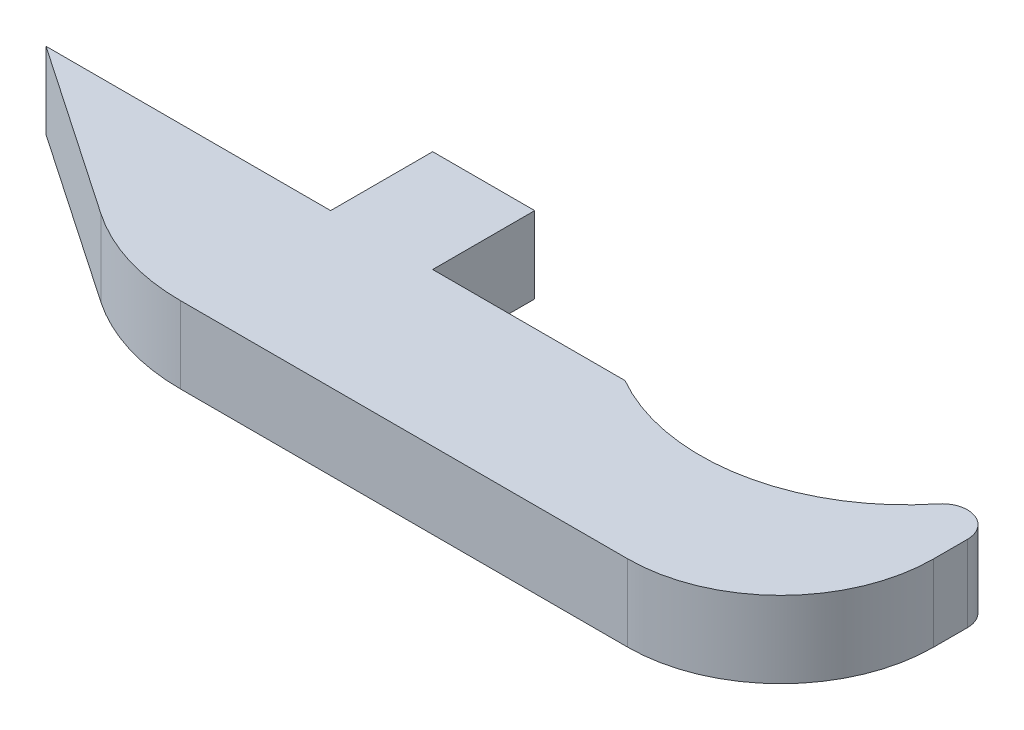
from build123d import *

# Parameters (mm, degrees)
BOSS_EXTRUDE1_DEPTH = 4.7625
FILLET1_R           = 9.525
FILLET2_START       = -1
FILLET2_DEPTH       = 7
FILLET4_R           = 12.7
SKETCH2_W           = 6.35
SKETCH2_H           = 6.35
BOSS_EXTRUDE2_DEPTH = 4.7625


with BuildPart() as part:
    # Sketch1 → Boss-Extrude1 (new body)
    with BuildSketch(Plane(origin=(0, 0, 0), x_dir=(1, 0, 0), z_dir=(0, 1, 0))):
        with BuildLine():
            ThreePointArc((58.42, 11.1252), (52.02098311, 0.025066571), (39.208498926, 0))
            Line((39.208498926, 0), (3.175, 0))
            Line((3.175, 0), (17.145, -9.525))
            Line((17.145, -9.525), (58.42, -9.525))
            Line((58.42, -9.525), (58.42, 11.1252))
        make_face()
    extrude(amount=BOSS_EXTRUDE1_DEPTH)

    # Fillet1
    fillet1_edges = [part.edges().sort_by_distance(p)[0] for p in [
        (58.42, 2.38125, 9.525),
    ]]
    fillet(fillet1_edges, radius=FILLET1_R)

    # Fillet2: read off the stored shape, not the designer's step
    # Fillet2 outline → Fillet2 (cut)
    with BuildSketch(Plane(origin=(0, 0, 0), x_dir=(1, 0, 0), z_dir=(0, 1, 0)).offset(FILLET2_START)):
        with BuildLine():
            ThreePointArc((58.42, 11.1252), (57.693069112, 6.868410541), (55.594669604, 3.094102059))
            ThreePointArc((55.594669604, 3.094102059), (57.359330379, 3.5976876), (58.42, 2.100154294))
            Line((58.42, 2.100154294), (58.42, 11.1252))
        make_face()
    extrude(amount=FILLET2_DEPTH, mode=Mode.SUBTRACT)

    # Fillet4
    fillet4_edges = [part.edges().sort_by_distance(p)[0] for p in [
        (17.145, 2.38125, 9.525),
    ]]
    fillet(fillet4_edges, radius=FILLET4_R)

    # Sketch2 → Boss-Extrude2 (add)
    with BuildSketch(Plane.XZ):
        with Locations((24.0645, -3.175)):
            Rectangle(SKETCH2_W, SKETCH2_H)
    extrude(amount=-BOSS_EXTRUDE2_DEPTH)


solid = part.part
